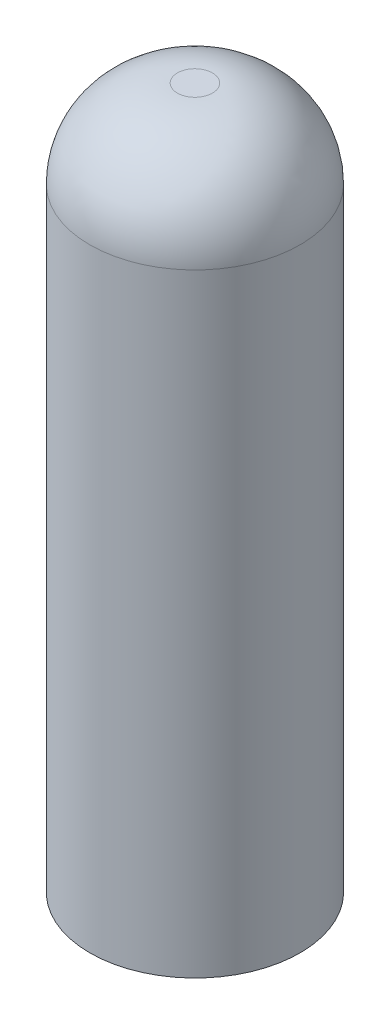
from build123d import *

# Parameters (mm, degrees)
SKETCH1_R           = 6
BOSS_EXTRUDE1_DEPTH = 40
FILLET2_R           = 5
SHELL1_OUTLINE_R    = 5
SHELL1_DEPTH        = 30


# Read off the part's stored shape, not the designer's step: Shell1
with BuildPart() as part:
    # Sketch1 → Boss-Extrude1 (new body)
    with BuildSketch(Plane(origin=(0, 0, 0), x_dir=(1, 0, 0), z_dir=(0, 1, 0))):
        with Locations(Location((0, 0, 0), (0, 0, 270))):
            Circle(SKETCH1_R)
    extrude(amount=BOSS_EXTRUDE1_DEPTH)

    # Fillet2
    fillet2_edges = [part.edges().sort_by_distance(p)[0] for p in [
        (0, 40, -6),
    ]]
    fillet(fillet2_edges, radius=FILLET2_R)

    # Shell1 outline → Shell1 (cut)
    with BuildSketch(Plane(origin=(0, 0, 0), x_dir=(1, 0, 0), z_dir=(0, 1, 0))):
        Circle(SHELL1_OUTLINE_R)
    extrude(amount=SHELL1_DEPTH, mode=Mode.SUBTRACT)


solid = part.part
